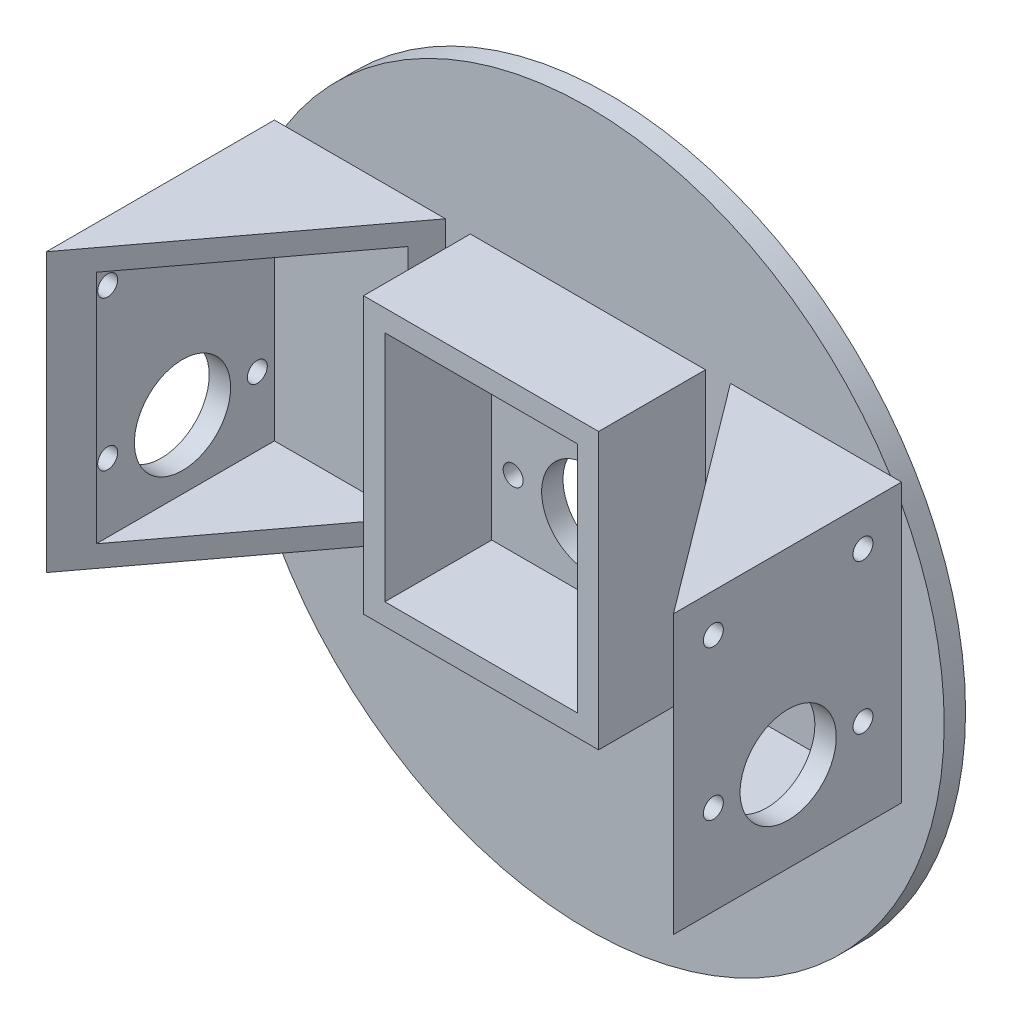
from build123d import *

# Parameters (mm, degrees)
EXTRUDE_START            = 26.4
EXTRUDE_3_DEPTH          = 39
SHELL_2_T                = -3
SKETCH_7_R               = 6.75
SKETCH_7_R_2             = 1.4
CUT_EXTRUDE_5_DEPTH      = 47.496881616
SKETCH_1_R               = 50
EXTRUDE_1_DEPTH          = 3
SKETCH_9_W               = 33
SKETCH_9_H               = 38.7
SKETCH_9_W_2             = 27
SKETCH_9_H_2             = 32.7
EXTRUDE_5_DEPTH          = 15
CUT_EXTRUDE_8_DEPTH      = 79.89866919
CUT_EXTRUDE_8_DEPTH_BACK = 79.89866919
SKETCH_8_R               = 1.4
SKETCH_8_R_2             = 6.5


# Read off the part's stored shape, not the designer's step: ﾐﾗｰ1
with BuildPart() as part:
    # ｽｹｯﾁ5 → ﾎﾞｽ - 押し出し3 (new body)
    with BuildSketch(Plane(origin=(0, 0, 0), x_dir=(1, 0, 0), z_dir=(0, 1, 0)).offset(EXTRUDE_START)):
        Polygon((-44, -32), (-44, 0), (-20, 0), align=None)
    extrude(amount=-EXTRUDE_3_DEPTH)

    # ｼｪﾙ2
    shell_2_openings = [part.faces().sort_by_distance(p)[0] for p in [
        (-32, 6.9, 16),
    ]]
    offset(amount=SHELL_2_T, openings=shell_2_openings, kind=Kind.INTERSECTION)

    # ｽｹｯﾁ7 → ｶｯﾄ - 押し出し5 (cut, through all)
    with BuildSketch(Plane(origin=(-41, 0, 0), x_dir=(0, 0, -1), z_dir=(1, 0, 0))):
        with Locations((-15.9, 0)):
            Circle(SKETCH_7_R)
        with Locations((-26.4, 0)):
            Circle(SKETCH_7_R_2)
        with Locations((-5.4, 0)):
            Circle(SKETCH_7_R_2)
        with Locations((-5.4, 21)):
            Circle(SKETCH_7_R_2)
        with Locations((-26.4, 21)):
            Circle(SKETCH_7_R_2)
    extrude(amount=-CUT_EXTRUDE_5_DEPTH, mode=Mode.SUBTRACT)

    # ｽｹｯﾁ1 → ﾎﾞｽ - 押し出し1 (add)
    with BuildSketch(Plane.XY):
        Circle(SKETCH_1_R)
    extrude(amount=-EXTRUDE_1_DEPTH)

    # ﾐﾗｰ1: part across plane


with BuildPart() as part_1:
    add(part.part)
    add(part.part.mirror(Plane(origin=(0, 0, 0), x_dir=(0, 0, 1), z_dir=(1, 0, 0))))

    # ｽｹｯﾁ9 → ﾎﾞｽ - 押し出し5 (add)
    with BuildSketch(Plane.XY):
        with Locations((0, 6.95)):
            Rectangle(SKETCH_9_W, SKETCH_9_H)
        with Locations((0, 6.95)):
            Rectangle(SKETCH_9_W_2, SKETCH_9_H_2, mode=Mode.SUBTRACT)
    extrude(amount=EXTRUDE_5_DEPTH)

    # ｽｹｯﾁ8 → ｶｯﾄ - 押し出し8 (cut, two sides: drawn at the far end of the back side and taken through both)
    with BuildSketch(Plane(origin=(0, 0, -3), x_dir=(-1, 0, 0), z_dir=(0, 0, -1)).offset(-CUT_EXTRUDE_8_DEPTH_BACK)):
        with Locations(Location((-10.5, 21, 0), (0, 0, 180))):
            Circle(SKETCH_8_R)
        with Locations(Location((10.5, 21, 0), (0, 0, 180))):
            Circle(SKETCH_8_R)
        with Locations(Location((-10.5, 0, 0), (0, 0, 180))):
            Circle(SKETCH_8_R)
        with Locations(Location((10.5, 0, 0), (0, 0, 180))):
            Circle(SKETCH_8_R)
        with Locations(Location((0, 0, 0), (0, 0, 180))):
            Circle(SKETCH_8_R_2)
    extrude(amount=CUT_EXTRUDE_8_DEPTH + CUT_EXTRUDE_8_DEPTH_BACK, mode=Mode.SUBTRACT)


solid = part_1.part
